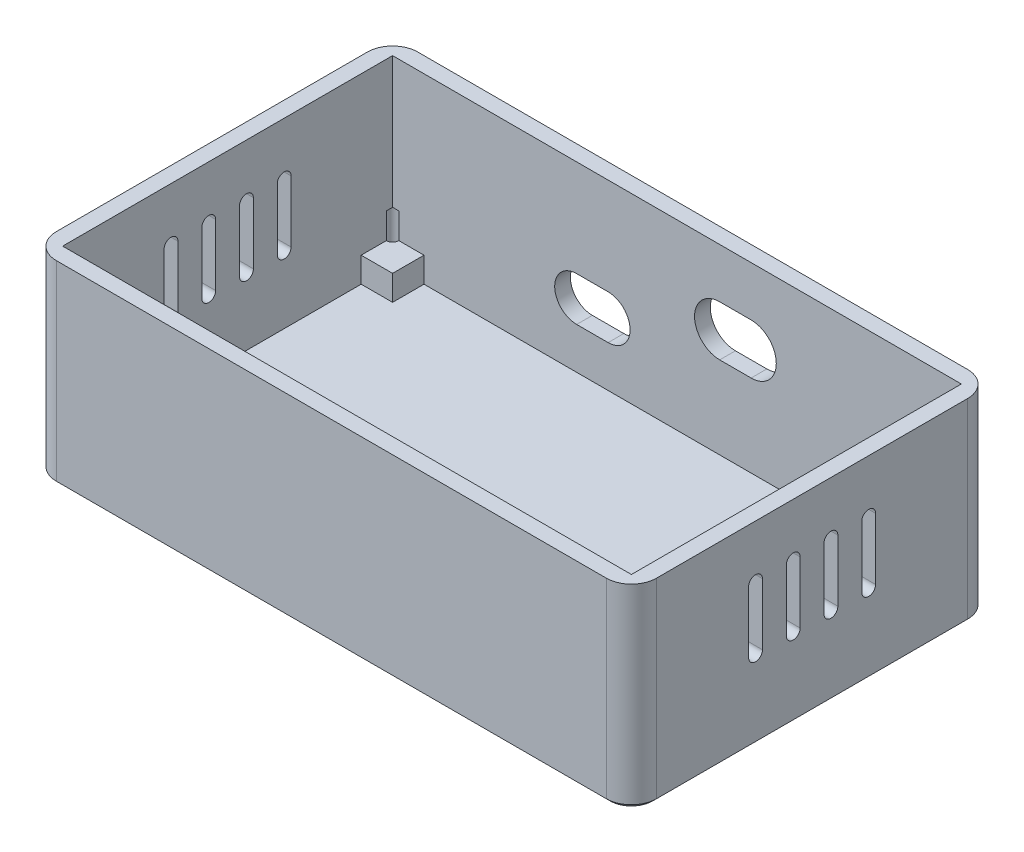
from build123d import *

# Parameters (mm, degrees)
CUERPO_DEPTH                  = 31
CROQUIS_HUECO_PCB_W           = 90.5
CROQUIS_HUECO_PCB_H           = 52.5
HUECO_PCB_DEPTH               = 29
CROQUIS_APOYOS_W              = 5
CROQUIS_APOYOS_H              = 5
APOYOS_PCB_DEPTH              = 4
CROQUIS_ALIVIOS_R             = 1
ALIVIOS_ESQUINAS_DEPTH        = 8.1
SALIDAS_USB_Y_PANEL_DEPTH     = 64.777935056
VENTILAS_LATERALES_DEPTH      = 64.777935056
VENTILAS_LATERALES_DEPTH_BACK = 64.777935056
CHAFLAN_BASE_SIZE             = 0.6


with BuildPart() as part:
    # Croquis_contorno → Cuerpo (new body)
    with BuildSketch(Plane(origin=(0, 0, 0), x_dir=(1, 0, 0), z_dir=(0, 1, 0))):
        with BuildLine():
            Line((-43.75, -28.75), (43.75, -28.75))
            ThreePointArc((43.75, -28.75), (46.578427125, -27.578427125), (47.75, -24.75))
            Line((47.75, -24.75), (47.75, 24.75))
            ThreePointArc((47.75, 24.75), (46.578427125, 27.578427125), (43.75, 28.75))
            Line((43.75, 28.75), (-43.75, 28.75))
            ThreePointArc((-43.75, 28.75), (-46.578427125, 27.578427125), (-47.75, 24.75))
            Line((-47.75, 24.75), (-47.75, -24.75))
            ThreePointArc((-47.75, -24.75), (-46.578427125, -27.578427125), (-43.75, -28.75))
        make_face()
    extrude(amount=CUERPO_DEPTH)

    # Croquis_hueco_PCB → Hueco_PCB (cut)
    with BuildSketch(Plane(origin=(0, 31, 0), x_dir=(1, 0, 0), z_dir=(0, 1, 0))):
        Rectangle(CROQUIS_HUECO_PCB_W, CROQUIS_HUECO_PCB_H)
    extrude(amount=-HUECO_PCB_DEPTH, mode=Mode.SUBTRACT)

    # Croquis_apoyos → Apoyos_PCB (add)
    with BuildSketch(Plane(origin=(0, 2, 0), x_dir=(1, 0, 0), z_dir=(0, 1, 0))):
        with Locations((-42.75, -23.75)):
            Rectangle(CROQUIS_APOYOS_W, CROQUIS_APOYOS_H)
        with Locations((-42.75, 23.75)):
            Rectangle(CROQUIS_APOYOS_W, CROQUIS_APOYOS_H)
        with Locations((42.75, -23.75)):
            Rectangle(CROQUIS_APOYOS_W, CROQUIS_APOYOS_H)
        with Locations((42.75, 23.75)):
            Rectangle(CROQUIS_APOYOS_W, CROQUIS_APOYOS_H)
    extrude(amount=APOYOS_PCB_DEPTH)

    # Croquis_alivios → Alivios_esquinas (cut)
    with BuildSketch(Plane(origin=(0, 2, 0), x_dir=(1, 0, 0), z_dir=(0, 1, 0))):
        with Locations((-45.25, -26.25)):
            Circle(CROQUIS_ALIVIOS_R)
        with Locations((-45.25, 26.25)):
            Circle(CROQUIS_ALIVIOS_R)
        with Locations((45.25, -26.25)):
            Circle(CROQUIS_ALIVIOS_R)
        with Locations((45.25, 26.25)):
            Circle(CROQUIS_ALIVIOS_R)
    extrude(amount=ALIVIOS_ESQUINAS_DEPTH, mode=Mode.SUBTRACT)

    # Croquis_salidas → Salidas_USB_y_panel (cut, through all)
    with BuildSketch(Plane.XY):
        with BuildLine():
            Line((6.8, 23.1), (11.8, 23.1))
            ThreePointArc((11.8, 23.1), (15.8, 19.1), (11.8, 15.1))
            Line((11.8, 15.1), (6.8, 15.1))
            ThreePointArc((6.8, 15.1), (2.8, 19.1), (6.8, 23.1))
        make_face()
        with BuildLine():
            Line((-15.96, 15.6), (-10.96, 15.6))
            ThreePointArc((-10.96, 15.6), (-7.46, 12.1), (-10.96, 8.6))
            Line((-10.96, 8.6), (-15.96, 8.6))
            ThreePointArc((-15.96, 8.6), (-19.46, 12.1), (-15.96, 15.6))
        make_face()
    extrude(amount=-SALIDAS_USB_Y_PANEL_DEPTH, mode=Mode.SUBTRACT)

    # Croquis_ventilas → Ventilas_laterales (cut, two sides: drawn at the far end of the back side and taken through both)
    with BuildSketch(Plane(origin=(0, 0, 0), x_dir=(0, 0, -1), z_dir=(1, 0, 0)).offset(-VENTILAS_LATERALES_DEPTH_BACK)):
        with BuildLine():
            Line((-10.1, 12.7), (-10.1, 22.5))
            ThreePointArc((-10.1, 22.5), (-9, 23.6), (-7.9, 22.5))
            Line((-7.9, 22.5), (-7.9, 12.7))
            ThreePointArc((-7.9, 12.7), (-9, 11.6), (-10.1, 12.7))
        make_face()
        with BuildLine():
            Line((-4.1, 12.7), (-4.1, 22.5))
            ThreePointArc((-4.1, 22.5), (-3, 23.6), (-1.9, 22.5))
            Line((-1.9, 22.5), (-1.9, 12.7))
            ThreePointArc((-1.9, 12.7), (-3, 11.6), (-4.1, 12.7))
        make_face()
        with BuildLine():
            Line((1.9, 12.7), (1.9, 22.5))
            ThreePointArc((1.9, 22.5), (3, 23.6), (4.1, 22.5))
            Line((4.1, 22.5), (4.1, 12.7))
            ThreePointArc((4.1, 12.7), (3, 11.6), (1.9, 12.7))
        make_face()
        with BuildLine():
            Line((7.9, 12.7), (7.9, 22.5))
            ThreePointArc((7.9, 22.5), (9, 23.6), (10.1, 22.5))
            Line((10.1, 22.5), (10.1, 12.7))
            ThreePointArc((10.1, 12.7), (9, 11.6), (7.9, 12.7))
        make_face()
    extrude(amount=VENTILAS_LATERALES_DEPTH + VENTILAS_LATERALES_DEPTH_BACK, mode=Mode.SUBTRACT)

    # Chaflan_base
    chaflan_base_edges = [part.edges().sort_by_distance(p)[0] for p in [
        (0, 0, 28.75),
        (46.578427125, 0, 27.578427125),
        (47.75, 0, 0),
        (46.578427125, 0, -27.578427125),
        (0, 0, -28.75),
        (-46.578427125, 0, -27.578427125),
        (-47.75, 0, 0),
        (-46.578427125, 0, 27.578427125),
    ]]
    chamfer(chaflan_base_edges, length=CHAFLAN_BASE_SIZE)


solid = part.part
